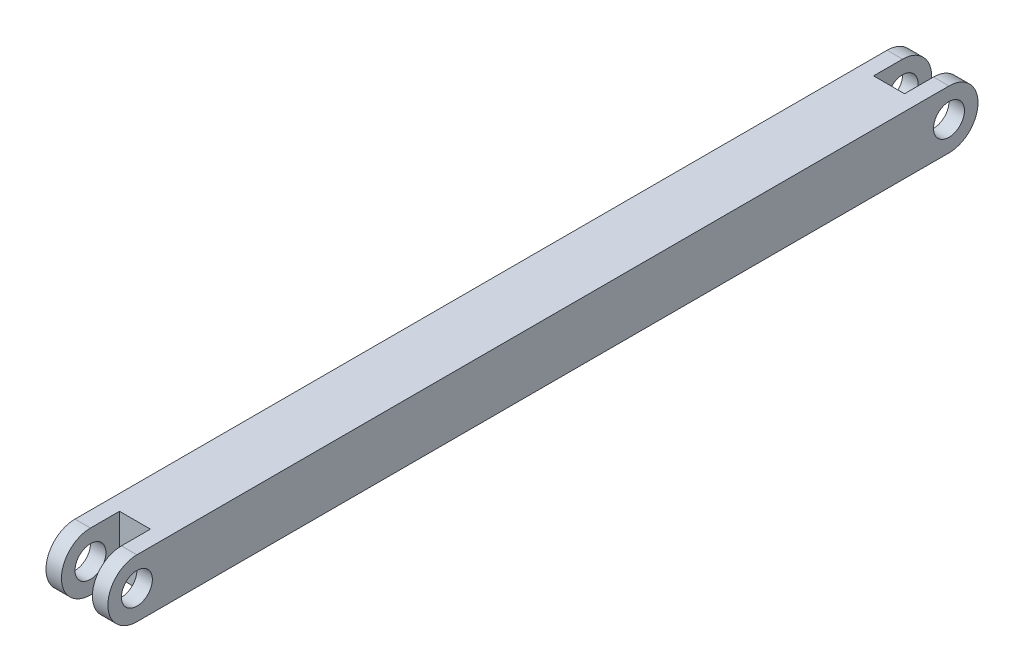
from build123d import *

# Parameters (mm, degrees)
EXTRUDE_1_DEPTH     = 16
SKETCH_3_W          = 8
SKETCH_3_H          = 15
CUT_EXTRUDE_1_DEPTH = 115.617843288
SKETCH_4_R          = 4
CUT_EXTRUDE_2_DEPTH = 114.879322091


with BuildPart() as part:
    # 草图2 → 凸台-拉伸1 (new body)
    with BuildSketch(Plane(origin=(0, 0, 0), x_dir=(0, 0, -1), z_dir=(1, 0, 0))):
        with BuildLine():
            Line((-105, -7.5), (105, -7.5))
            ThreePointArc((105, -7.5), (112.5, 0), (105, 7.5))
            Line((105, 7.5), (-105, 7.5))
            ThreePointArc((-105, 7.5), (-112.5, 0), (-105, -7.5))
        make_face()
    extrude(amount=EXTRUDE_1_DEPTH)

    # 草图3 → 切除-拉伸1 (cut, through all)
    with BuildSketch(Plane(origin=(0, 7.5, 0), x_dir=(1, 0, 0), z_dir=(0, 1, 0))):
        with Locations((8, -105)):
            Rectangle(SKETCH_3_W, SKETCH_3_H)
        with Locations((8, 105)):
            Rectangle(SKETCH_3_W, SKETCH_3_H)
    extrude(amount=-CUT_EXTRUDE_1_DEPTH, mode=Mode.SUBTRACT)

    # 草图4 → 切除-拉伸2 (cut, through all)
    with BuildSketch(Plane(origin=(16, 0, 0), x_dir=(0, 0, -1), z_dir=(1, 0, 0))):
        with Locations((-105, 0)):
            Circle(SKETCH_4_R)
        with Locations((105, 0)):
            Circle(SKETCH_4_R)
    extrude(amount=-CUT_EXTRUDE_2_DEPTH, mode=Mode.SUBTRACT)


solid = part.part
